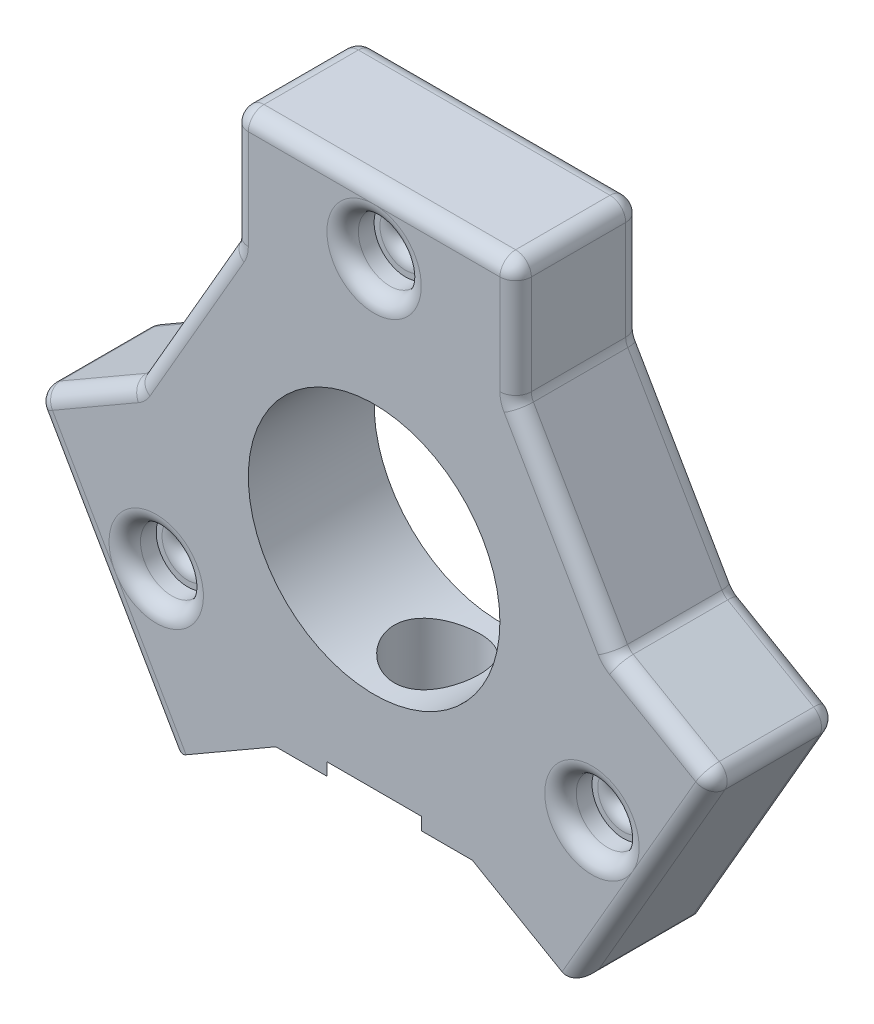
from build123d import *

# Parameters (mm, degrees)
SKETCH3_R           = 6.35
SKETCH3_R_2         = 0.5
BOSS_EXTRUDE2_DEPTH = 6.35
SKETCH12_R          = 1.5875
CUT_EXTRUDE4_DEPTH  = 1.5875
CUT_EXTRUDE5_START  = -1.5875
SKETCH13_R          = 1.5875
CUT_EXTRUDE5_DEPTH  = 1.5875
FILLET1_R           = 0.79375
FILLET2_R           = 0.79375


# Read off the part's stored shape, not the designer's step: CBORE for #8 Socket Head Cap Screw1
with BuildPart() as part:
    # Sketch3 → Boss-Extrude2 (new body)
    with BuildSketch(Plane.XY):
        Polygon((7.14375, 9.851662043), (7.14375, 15.875), (0, 15.875), (-7.14375, 15.875), (-7.14375, 9.851662043), (-12.103664599, 1.260837957), (-17.320028285, -1.750831022), (-13.748153285, -7.9375), (-10.176278285, -14.124168978), (-4.959914599, -11.1125), (4.959914599, -11.1125), (10.176278285, -14.124168978), (13.748153285, -7.9375), (17.320028285, -1.750831022), (12.103664599, 1.260837957), align=None)
        Circle(SKETCH3_R, mode=Mode.SUBTRACT)
        with Locations((-10.998522628, -6.35)):
            Circle(SKETCH3_R_2, mode=Mode.SUBTRACT)
        with Locations((10.998522628, -6.35)):
            Circle(SKETCH3_R_2, mode=Mode.SUBTRACT)
        with Locations((0, 12.7)):
            Circle(SKETCH3_R_2, mode=Mode.SUBTRACT)
    extrude(amount=BOSS_EXTRUDE2_DEPTH)

    # Sketch12 → Cut-Extrude4 (cut)
    with BuildSketch(Plane.XY.offset(6.35)):
        with Locations((0, 12.7)):
            Circle(SKETCH12_R)
        with Locations((10.998522628, -6.35)):
            Circle(SKETCH12_R)
        with Locations((-10.998522628, -6.35)):
            Circle(SKETCH12_R)
    extrude(amount=-CUT_EXTRUDE4_DEPTH, mode=Mode.SUBTRACT)

    # Sketch13 → Cut-Extrude5 (cut)
    with BuildSketch(Plane(origin=(0, 0, 0), x_dir=(-1, 0, 0), z_dir=(0, 0, -1)).offset(CUT_EXTRUDE5_START)):
        with Locations(Location((-10.998522628, -6.35, 0), (0, 0, 180))):
            Circle(SKETCH13_R)
        with Locations(Location((0, 12.7, 0), (0, 0, 180))):
            Circle(SKETCH13_R)
        with Locations(Location((10.998522628, -6.35, 0), (0, 0, 180))):
            Circle(SKETCH13_R)
    extrude(amount=CUT_EXTRUDE5_DEPTH, mode=Mode.SUBTRACT)

    # Fillet1
    fillet1_edges = [part.edges().sort_by_distance(p)[0] for p in [
        (-0.5, 12.7, 4.7625),
        (-1.5875, 12.7, 6.35),
        (10.498522628, -6.35, 4.7625),
        (9.411022628, -6.35, 6.35),
        (-11.498522628, -6.35, 4.7625),
        (-12.586022628, -6.35, 6.35),
        (10.498522628, -6.35, 1.5875),
        (9.411022628, -6.35, 0),
        (-0.5, 12.7, 1.5875),
        (-1.5875, 12.7, 0),
        (-11.498522628, -6.35, 1.5875),
        (-12.586022628, -6.35, 0),
    ]]
    fillet(fillet1_edges, radius=FILLET1_R)

    # Fillet2
    fillet2_edges = [part.edges().sort_by_distance(p)[0] for p in [
        (0, 15.875, 6.35),
        (14.711846442, -0.244996533, 0),
        (13.748153285, -7.9375, 0),
        (-13.748153285, -7.9375, 0),
        (-7.14375, 12.863331022, 6.35),
        (-14.711846442, -0.244996533, 0),
        (-9.6237073, 5.55625, 0),
        (-7.14375, 12.863331022, 0),
        (0, 15.875, 0),
        (7.14375, 12.863331022, 0),
        (9.6237073, 5.55625, 0),
        (-9.6237073, 5.55625, 6.35),
        (-14.711846442, -0.244996533, 6.35),
        (12.103664599, 1.260837957, 3.175),
        (17.320028285, -1.750831022, 3.175),
        (10.176278285, -14.124168978, 3.175),
        (-10.176278285, -14.124168978, 3.175),
        (-17.320028285, -1.750831022, 3.175),
        (-12.103664599, 1.260837957, 3.175),
        (-7.14375, 9.851662043, 3.175),
        (-13.748153285, -7.9375, 6.35),
        (-7.14375, 15.875, 3.175),
        (7.14375, 15.875, 3.175),
        (7.14375, 9.851662043, 3.175),
        (9.6237073, 5.55625, 6.35),
        (13.748153285, -7.9375, 6.35),
        (14.711846442, -0.244996533, 6.35),
        (7.14375, 12.863331022, 6.35),
    ]]
    fillet(fillet2_edges, radius=FILLET2_R - 0.0001)  # a hair under: the kernel refuses the full size

    # CBORE for #8 Socket Head Cap Screw1 outl → CBORE for #8 Socket Head Cap Screw1 (revolve, cut)
    with BuildSketch(Plane.XY.offset(3.175)):
        Polygon((0, -11.1125), (3.96875, -11.1125), (3.96875, -10.4775), (2.15265, -10.4775), (2.15265, -5.973945047), (0, -5.973945047), align=None)
    revolve(axis=Axis((0, 0, 3.175), (0, 1, 0)), mode=Mode.SUBTRACT)


solid = part.part
